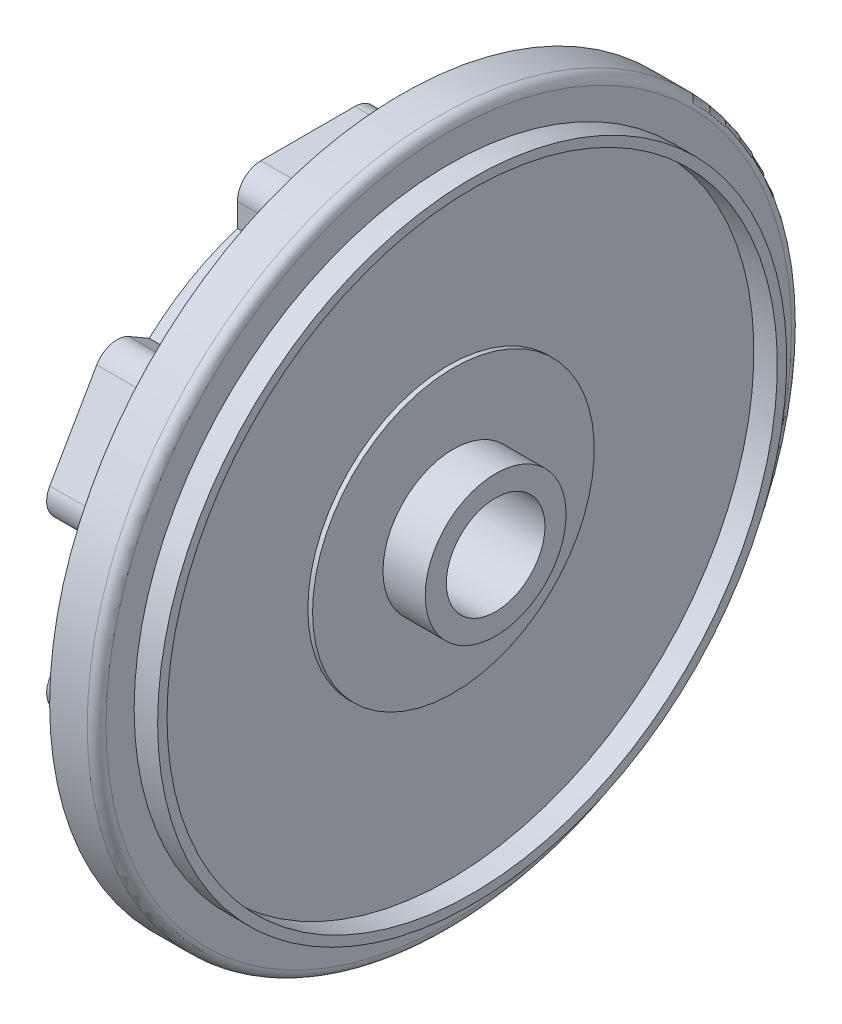
from build123d import *

# Parameters (mm, degrees)
FILLET1_R           = 0.2
BOSS_EXTRUDE1_START = 2
SKETCH2_R           = 5
SKETCH2_R_2         = 1.05
BOSS_EXTRUDE1_DEPTH = 2
BOSS_EXTRUDE2_DEPTH = 1


with BuildPart() as part:
    # Sketch1 → Revolve1 (revolve)
    with BuildSketch(Plane.XY):
        Polygon((3, 1.05), (3, 7.5), (4, 7.5), (4, 6.7), (4.5, 6.7), (4.5, 6.5), (4, 6.5), (4, 3), (4.1, 3), (4.1, 1.5), (5, 1.5), (5, 1.05), align=None)
    revolve(axis=Axis((0, 0, 0), (1, 0, 0)))

    # Fillet1
    fillet1_edges = [part.edges().sort_by_distance(p)[0] for p in [
        (4, -7.5, 0),
    ]]
    fillet(fillet1_edges, radius=FILLET1_R)

    # Sketch2 → Boss-Extrude1 (add)
    with BuildSketch(Plane.ZY.offset(-3).offset(BOSS_EXTRUDE1_START)):
        Circle(SKETCH2_R)
        Circle(SKETCH2_R_2, mode=Mode.SUBTRACT)
    extrude(amount=-BOSS_EXTRUDE1_DEPTH)

    # Sketch3 → Boss-Extrude2 (add)
    with BuildSketch(Plane.ZY.offset(-1)):
        with BuildLine():
            Line((-1, 5.769696007), (1, 5.769696007))
            ThreePointArc((1, 5.769696007), (1.353553391, 5.623249398), (1.5, 5.269696007))
            Line((1.5, 5.269696007), (1.5, 4.769696007))
            ThreePointArc((1.5, 4.769696007), (0, 5), (-1.5, 4.769696007))
            Line((-1.5, 4.769696007), (-1.5, 5.269696007))
            ThreePointArc((-1.5, 5.269696007), (-1.353553391, 5.623249398), (-1, 5.769696007))
        make_face()
        with BuildLine():
            Line((4.496703314, 3.750873407), (5.496703314, 2.0188226))
            ThreePointArc((5.496703314, 2.0188226), (5.546653526, 1.639413077), (5.313690612, 1.335809898))
            Line((5.313690612, 1.335809898), (4.88067791, 1.085809898))
            ThreePointArc((4.88067791, 1.085809898), (4.330127019, 2.5), (3.38067791, 3.683886109))
            Line((3.38067791, 3.683886109), (3.813690612, 3.933886109))
            ThreePointArc((3.813690612, 3.933886109), (4.193100135, 3.98383632), (4.496703314, 3.750873407))
        make_face()
        with BuildLine():
            Line((5.496703314, -2.0188226), (4.496703314, -3.750873407))
            ThreePointArc((4.496703314, -3.750873407), (4.193100135, -3.98383632), (3.813690612, -3.933886109))
            Line((3.813690612, -3.933886109), (3.38067791, -3.683886109))
            ThreePointArc((3.38067791, -3.683886109), (4.330127019, -2.5), (4.88067791, -1.085809898))
            Line((4.88067791, -1.085809898), (5.313690612, -1.335809898))
            ThreePointArc((5.313690612, -1.335809898), (5.546653526, -1.639413077), (5.496703314, -2.0188226))
        make_face()
        with BuildLine():
            Line((1.5, -5.269696007), (1.5, -4.769696007))
            ThreePointArc((1.5, -4.769696007), (0, -5), (-1.5, -4.769696007))
            Line((-1.5, -4.769696007), (-1.5, -5.269696007))
            ThreePointArc((-1.5, -5.269696007), (-1.353553391, -5.623249398), (-1, -5.769696007))
            Line((-1, -5.769696007), (1, -5.769696007))
            ThreePointArc((1, -5.769696007), (1.353553391, -5.623249398), (1.5, -5.269696007))
        make_face()
        with BuildLine():
            Line((-3.813690612, -3.933886109), (-3.38067791, -3.683886109))
            ThreePointArc((-3.38067791, -3.683886109), (-4.330127019, -2.5), (-4.88067791, -1.085809898))
            Line((-4.88067791, -1.085809898), (-5.313690612, -1.335809898))
            ThreePointArc((-5.313690612, -1.335809898), (-5.546653526, -1.639413077), (-5.496703314, -2.0188226))
            Line((-5.496703314, -2.0188226), (-4.496703314, -3.750873407))
            ThreePointArc((-4.496703314, -3.750873407), (-4.193100135, -3.98383632), (-3.813690612, -3.933886109))
        make_face()
        with BuildLine():
            Line((-5.313690612, 1.335809898), (-4.88067791, 1.085809898))
            ThreePointArc((-4.88067791, 1.085809898), (-4.330127019, 2.5), (-3.38067791, 3.683886109))
            Line((-3.38067791, 3.683886109), (-3.813690612, 3.933886109))
            ThreePointArc((-3.813690612, 3.933886109), (-4.193100135, 3.98383632), (-4.496703314, 3.750873407))
            Line((-4.496703314, 3.750873407), (-5.496703314, 2.0188226))
            ThreePointArc((-5.496703314, 2.0188226), (-5.546653526, 1.639413077), (-5.313690612, 1.335809898))
        make_face()
    extrude(amount=-BOSS_EXTRUDE2_DEPTH)


solid = part.part
